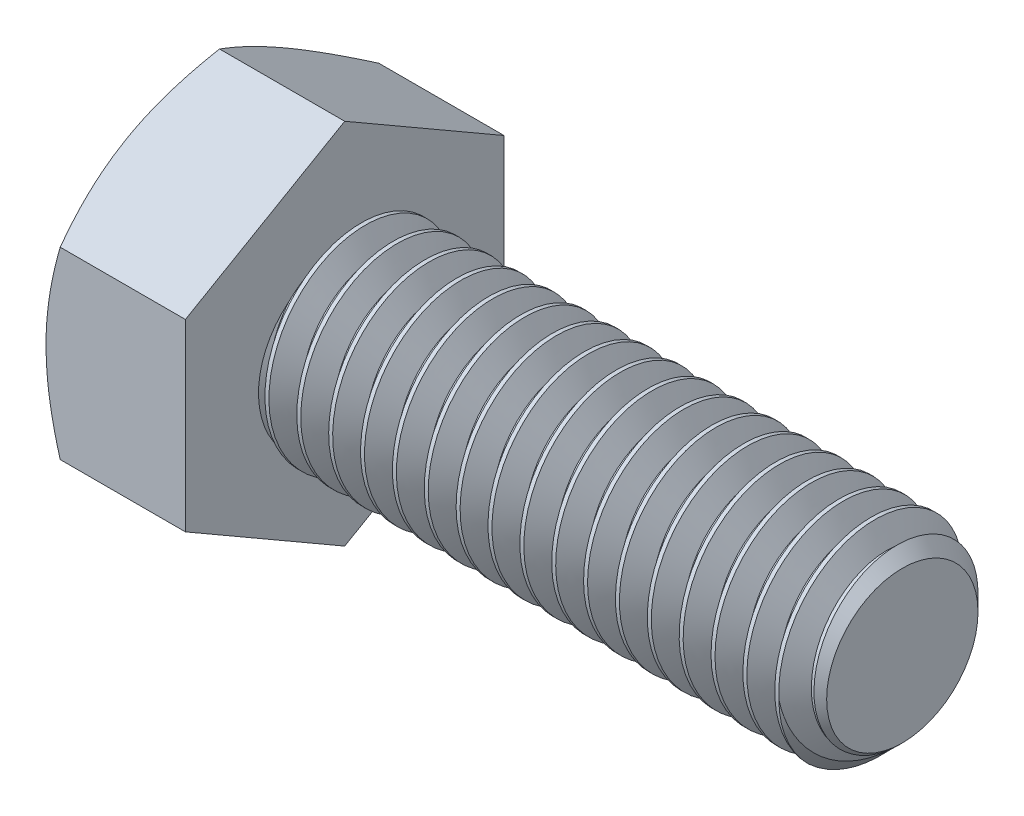
from build123d import *

# Parameters (mm, degrees)
SKETCH2_R           = 2.5
BOSS_EXTRUDE1_DEPTH = 14
CHAMFER1_SIZE       = 0.6
CUT_SWEEP1_PITCH    = 0.8
BOSS_EXTRUDE2_DEPTH = 3.5
SKETCH6_OUTSIDE_W   = 81.944
SKETCH6_OUTSIDE_H   = 83.182
SKETCH6_OUTSIDE_R   = 4
CUT_EXTRUDE1_DEPTH  = 19.536001148
CUT_EXTRUDE1_DRAFT  = -60


with BuildPart() as part:
    # Sketch2 → Boss-Extrude1 (new body)
    with BuildSketch(Plane(origin=(8.75, 0, 0), x_dir=(0, 0, -1), z_dir=(1, 0, 0))):
        Circle(SKETCH2_R)
    extrude(amount=-BOSS_EXTRUDE1_DEPTH)

    # Chamfer1
    chamfer1_edges = [part.edges().sort_by_distance(p)[0] for p in [
        (8.75, 0, 2.5),
    ]]
    chamfer(chamfer1_edges, length=CHAMFER1_SIZE)

    # Cut-Sweep1: the profile of Sketch5 profile screwed along a right-hand helix of 18.5 turns, 8 arcs to a turn; built about Z, then put on its axis
    cut_sweep1_z = Axis((0, 0, 0), (0, 0, 1))
    cut_sweep1_corners = [(2.5003, 0, 0.000173205), (1.980384758, 0, -0.3), (1.980384758, 0, -0.4), (2.5003, 0, -0.700173205)]
    with BuildLine(mode=Mode.PRIVATE) as cut_sweep1_profile:
        Line(cut_sweep1_corners[0], cut_sweep1_corners[1])
        Line(cut_sweep1_corners[1], cut_sweep1_corners[2])
        Line(cut_sweep1_corners[2], cut_sweep1_corners[3])
        Line(cut_sweep1_corners[3], cut_sweep1_corners[0])
    cut_sweep1_cap = Face(cut_sweep1_profile.wire())
    cut_sweep1_turn_angles = [0, 22.5, 45, 67.5, 90, 112.5, 135, 157.5, 180, 202.5, 225, 247.5, 270, 292.5, 315, 337.5, 360]
    cut_sweep1_turn_weights = [1, 0.9238795325112867, 1, 0.9238795325112867, 1, 0.9238795325112867, 1, 0.9238795325112867, 1, 0.9238795325112867, 1, 0.9238795325112867, 1, 0.9238795325112867, 1, 0.9238795325112867, 1]
    cut_sweep1_turn_rails = [Edge.make_bspline([Vector(p[0], p[1], 0).rotate(cut_sweep1_z, cut_sweep1_turn_angles[k]) / cut_sweep1_turn_weights[k] + Vector(0, 0, p[2] + CUT_SWEEP1_PITCH * cut_sweep1_turn_angles[k] / 360) for k in range(17)], [0, 0, 0, 1, 1, 2, 2, 3, 3, 4, 4, 5, 5, 6, 6, 7, 7, 8, 8, 8], 2, cut_sweep1_turn_weights) for p in cut_sweep1_corners]
    cut_sweep1_turn_sides = [Face.make_surface_from_curves(cut_sweep1_turn_rails[p[0]], cut_sweep1_turn_rails[p[1]]) for p in [(0, 1), (1, 2), (2, 3), (3, 0)]]
    cut_sweep1_last_angles = [6480, 6502.5, 6525, 6547.5, 6570, 6592.5, 6615, 6637.5, 6660]
    cut_sweep1_last_weights = [1, 0.9238795325112867, 1, 0.9238795325112867, 1, 0.9238795325112867, 1, 0.9238795325112442, 1]
    cut_sweep1_last_rails = [Edge.make_bspline([Vector(p[0], p[1], 0).rotate(cut_sweep1_z, cut_sweep1_last_angles[k]) / cut_sweep1_last_weights[k] + Vector(0, 0, p[2] + CUT_SWEEP1_PITCH * cut_sweep1_last_angles[k] / 360) for k in range(9)], [0, 0, 0, 1, 1, 2, 2, 3, 3, 4, 4, 4], 2, cut_sweep1_last_weights) for p in cut_sweep1_corners]
    cut_sweep1_last_sides = [Face.make_surface_from_curves(cut_sweep1_last_rails[p[0]], cut_sweep1_last_rails[p[1]]) for p in [(0, 1), (1, 2), (2, 3), (3, 0)]]
    cut_sweep1 = Plane(origin=(8.75, 0, 0), x_dir=(0, 1, 0), z_dir=(-1, 0, 0)) * Solid(Shell([*[p.moved(Location((0, 0, CUT_SWEEP1_PITCH * i))) for i in range(18) for p in cut_sweep1_turn_sides], *cut_sweep1_last_sides, cut_sweep1_cap, cut_sweep1_cap.rotate(cut_sweep1_z, 6660).moved(Location((0, 0, CUT_SWEEP1_PITCH * 6660 / 360)))]))
    add(cut_sweep1, mode=Mode.SUBTRACT)

    # Sketch3 → Boss-Extrude2 (add)
    with BuildSketch(Plane.ZY.offset(5.25)):
        Polygon((-4, -2.309401077), (0, -4.618802154), (4, -2.309401077), (4, 2.309401077), (0, 4.618802154), (-4, 2.309401077), align=None)
    extrude(amount=BOSS_EXTRUDE2_DEPTH)


with BuildPart() as cut_extrude1_tool:
    # Sketch6 outside → Cut-Extrude1 (with draft: the straight prism first)
    with BuildSketch(Plane.ZY.offset(8.75)):
        Rectangle(SKETCH6_OUTSIDE_W, SKETCH6_OUTSIDE_H)
        Circle(SKETCH6_OUTSIDE_R, mode=Mode.SUBTRACT)
    extrude(amount=-CUT_EXTRUDE1_DEPTH)
    # Cut-Extrude1: the draft: its side faces are tilted about the plane it starts from
    cut_extrude1_sides = [cut_extrude1_tool.faces().sort_by_distance(p)[0] for p in [
        (1.018000574, -41.591, 0),
        (1.018000574, 0, 40.972),
        (1.018000574, 41.591, 0),
        (1.018000574, 0, -40.972),
        (1.018000574, 0, -4),
    ]]
    draft(cut_extrude1_sides, Plane.ZY.offset(8.75), CUT_EXTRUDE1_DRAFT)


with BuildPart() as part_1:
    add(part.part)

    # Cut-Extrude1: cut by cut_extrude1_tool
    add(cut_extrude1_tool.part, mode=Mode.SUBTRACT)


solid = part_1.part
